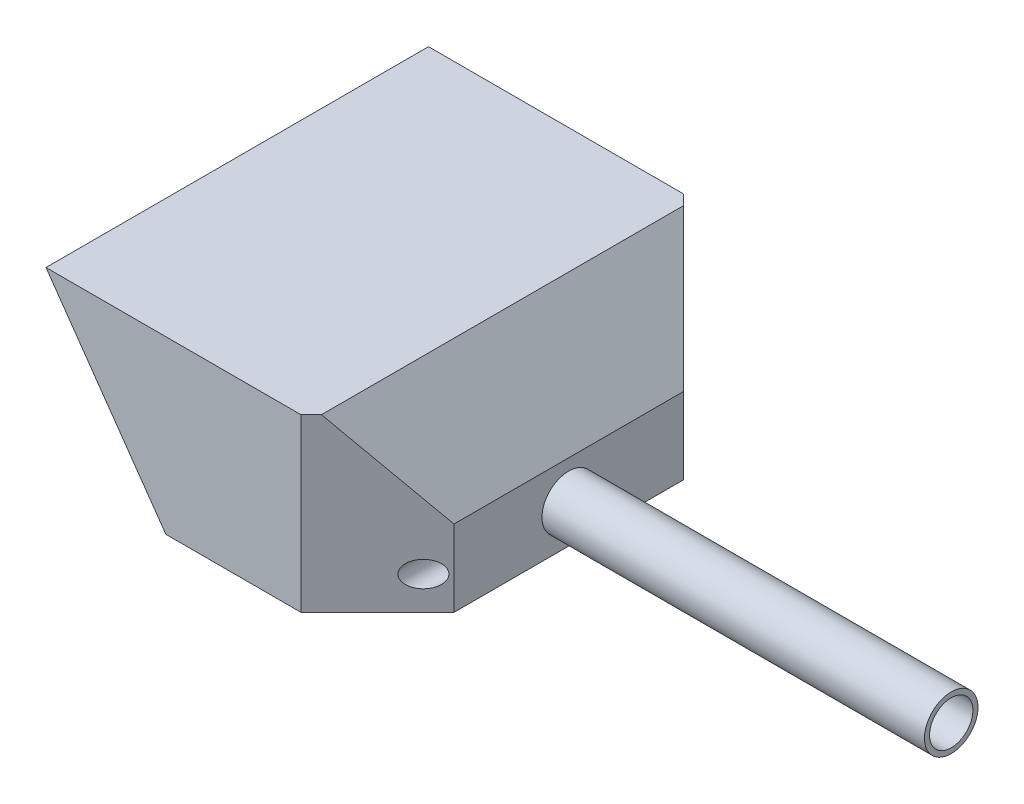
from build123d import *

# Parameters (mm, degrees)
EXTRUDE_1_DEPTH          = 75
SKETCH_2_R               = 10.5
SKETCH_2_R_2             = 8.5
EXTRUDE_2_DEPTH          = 150
CHAMFER_1_SIZE           = 30
CUT_EXTRUDE_1_DEPTH      = 202.013659398
CUT_EXTRUDE_1_DEPTH_BACK = 202.013659398
SKETCH_3_R               = 5


with BuildPart() as part:
    # 草图1 → 凸台-拉伸1 (new, symmetric)
    with BuildSketch(Plane.XY):
        Polygon((0, 0), (-59, 0), (-106, 67.122956317), (-1.993773854, 67.122956317), (24, 30), (24, 0), align=None)
    extrude(amount=EXTRUDE_1_DEPTH, both=True)

    # 草图2 → 凸台-拉伸2 (add)
    with BuildSketch(Plane(origin=(24, 0, 0), x_dir=(0, 0, -1), z_dir=(1, 0, 0))):
        with Locations((0, 15)):
            Circle(SKETCH_2_R)
        with Locations((0, 15)):
            Circle(SKETCH_2_R_2, mode=Mode.SUBTRACT)
    extrude(amount=EXTRUDE_2_DEPTH)

    # 倒角1
    chamfer_1_edges = [part.edges().sort_by_distance(p)[0] for p in [
        (24, 15, 75),
        (24, 15, -75),
    ]]
    chamfer(chamfer_1_edges, length=CHAMFER_1_SIZE)

    # 草图3 → 切除-拉伸1 (cut, two sides: drawn at the far end of the back side and taken through both)
    with BuildSketch(Plane.XY.offset(-CUT_EXTRUDE_1_DEPTH_BACK)):
        with Locations((18, 13)):
            Circle(SKETCH_3_R)
    extrude(amount=CUT_EXTRUDE_1_DEPTH + CUT_EXTRUDE_1_DEPTH_BACK, mode=Mode.SUBTRACT)


solid = part.part
